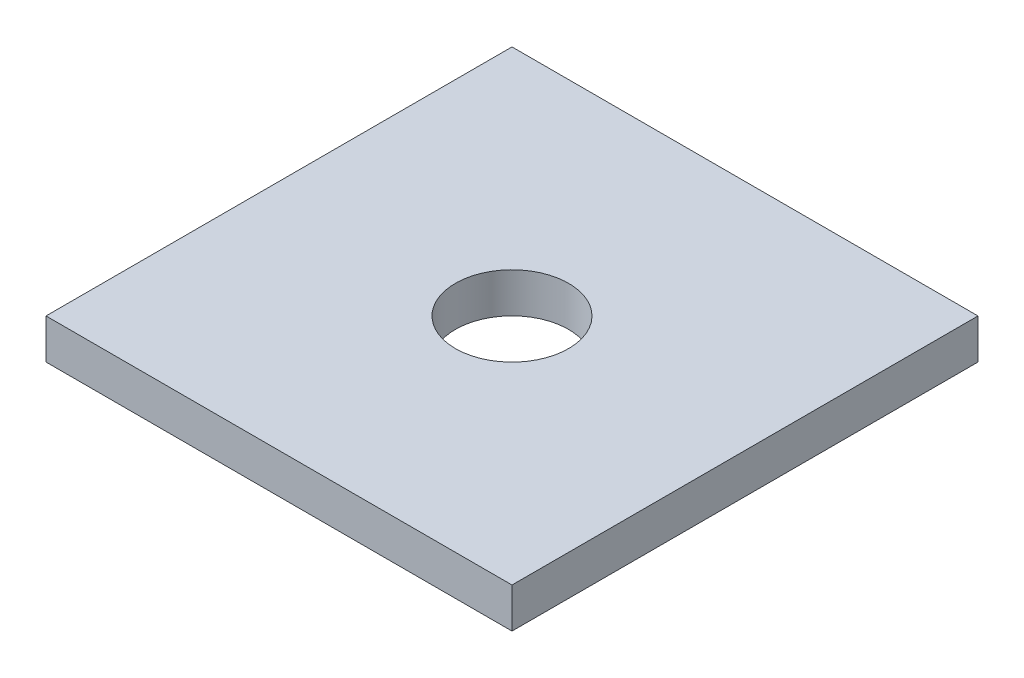
from build123d import *

# Parameters (mm, degrees)
SKETCH_1_W             = 70
SKETCH_1_H             = 70
SKETCH_1_R             = 8.5
SM_BASE_FLANGE_1_DEPTH = 6


# Sheet-metal steps are written as plain solids
with BuildPart() as part:
    # Sketch 1 → Базовая кромка1 (new body)
    with BuildSketch(Plane(origin=(0, 0, 0), x_dir=(1, 0, 0), z_dir=(0, 1, 0))):
        Rectangle(SKETCH_1_W, SKETCH_1_H)
        with Locations(Location((0, 0, 0), (0, 0, 270))):
            Circle(SKETCH_1_R, mode=Mode.SUBTRACT)
    extrude(amount=-SM_BASE_FLANGE_1_DEPTH)


solid = part.part
